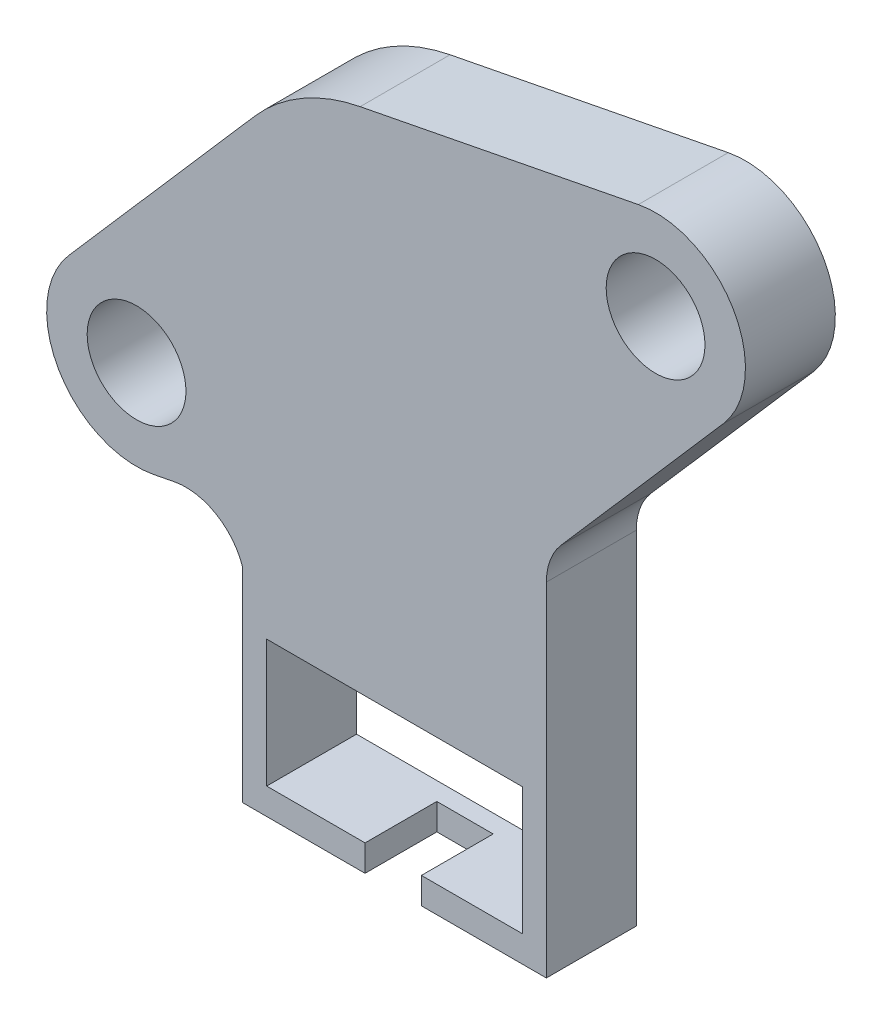
from build123d import *

# Parameters (mm, degrees)
SKETCH1_R               = 2.6162
BOSS_EXTRUDE1_DEPTH     = 4.7625
BOSS_EXTRUDE2_START     = -3.81
BOSS_EXTRUDE2_DEPTH     = 3.81
CUT_EXTRUDE1_DEPTH      = 47.372529043
CUT_EXTRUDE1_DEPTH_BACK = 1.524
SKETCH3_W               = 2.985
SKETCH3_H               = 3.8022


with BuildPart() as part:
    # Sketch1 → Boss-Extrude1 (new body)
    with BuildSketch(Plane.XY.offset(2.107322193)):
        with BuildLine():
            Line((-0.976080172, -5.160558452), (15.11103392, -5.160554616))
            Line((15.11103392, -5.160554616), (15.111029589, 13.002746336))
            ThreePointArc((15.111029589, 13.002746336), (15.312546971, 14.115862595), (15.891518981, 15.087679694))
            Line((15.891518981, 15.087679694), (24.488045189, 24.960647863))
            ThreePointArc((24.488045189, 24.960647863), (25.020724695, 30.469297747), (19.983753108, 32.762306303))
            Line((19.983753108, 32.762306303), (5.247640051, 29.885468019))
            ThreePointArc((5.247640051, 29.885468019), (2.188775836, 28.740388475), (-0.332323255, 26.663872928))
            Line((-0.332323255, 26.663872928), (-10.19178942, 15.340439107))
            ThreePointArc((-10.19178942, 15.340439107), (-10.724468925, 9.831789223), (-5.687497339, 7.538780667))
            Line((-5.687497339, 7.538780667), (-4.598119195, 7.751453082))
            ThreePointArc((-4.598119195, 7.751453082), (-2.387631267, 7.376407845), (-0.976082746, 5.634441548))
            Line((-0.976082746, 5.634441548), (-0.976080172, -5.160558452))
        make_face()
        with Locations((-6.600023508, 12.213040207)):
            Circle(SKETCH1_R, mode=Mode.SUBTRACT)
        with BuildLine():
            Line((13.841030203, 10.42913287), (13.841033587, -3.763554919))
            Line((13.841033587, -3.763554919), (0.293919495, -3.763558149))
            Line((0.293919495, -3.763558149), (0.293916229, 9.932994282))
            ThreePointArc((0.293916229, 9.932994282), (-0.000418872, 12.651350758), (-0.869779891, 15.243706156))
            Line((-0.869779891, 15.243706156), (-0.976085093, 15.474629701))
            ThreePointArc((-0.976085093, 15.474629701), (6.540220685, 27.79826422), (15.111028831, 16.183270977))
            Line((15.111028831, 16.183270977), (14.582439814, 14.704895001))
            ThreePointArc((14.582439814, 14.704895001), (14.027755034, 12.598915738), (13.841030203, 10.42913287))
        make_face(mode=Mode.SUBTRACT)
        with Locations((20.896279277, 28.088046763)):
            Circle(SKETCH1_R, mode=Mode.SUBTRACT)
    extrude(amount=BOSS_EXTRUDE1_DEPTH)

    # Sketch2 → Boss-Extrude2 (add)
    with BuildSketch(Plane.XY.offset(6.869822193).offset(BOSS_EXTRUDE2_START)):
        with BuildLine():
            Line((0.293917887, 2.979402319), (13.841031979, 2.979402319))
            Line((13.841031979, 2.979402319), (13.841030203, 10.42913287))
            ThreePointArc((13.841030203, 10.42913287), (14.027755034, 12.598915738), (14.582439814, 14.704895001))
            Line((14.582439814, 14.704895001), (15.111028831, 16.183270977))
            ThreePointArc((15.111028831, 16.183270977), (6.540220685, 27.79826422), (-0.976085093, 15.474629701))
            Line((-0.976085093, 15.474629701), (-0.869779891, 15.243706156))
            ThreePointArc((-0.869779891, 15.243706156), (-0.000418548, 12.651349279), (0.293916229, 9.932991253))
            Line((0.293916229, 9.932991253), (0.293917887, 2.979402319))
        make_face()
    extrude(amount=BOSS_EXTRUDE2_DEPTH)

    # Sketch3 → Cut-Extrude1 (cut, two sides: drawn at the far end of the back side and taken through both)
    with BuildSketch(Plane(origin=(1.231e-06, -5.160558219, 0), x_dir=(0.9999999999999716, 2.384595945401799e-07, 0), z_dir=(2.384595945401799e-07, -0.9999999999999716, 0)).offset(-CUT_EXTRUDE1_DEPTH_BACK)):
        with Locations((6.998909914, 4.968722193)):
            Rectangle(SKETCH3_W, SKETCH3_H)
    extrude(amount=CUT_EXTRUDE1_DEPTH + CUT_EXTRUDE1_DEPTH_BACK, mode=Mode.SUBTRACT)


solid = part.part
